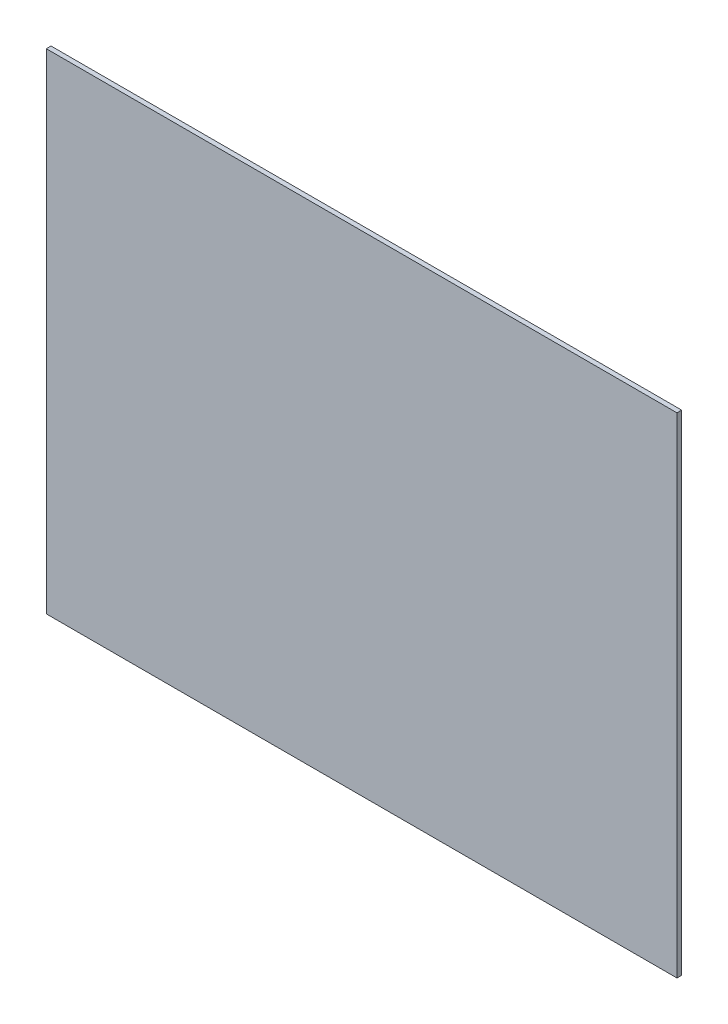
from build123d import *

# Parameters (mm, degrees)
SKETCH1_W           = 536
SKETCH1_H           = 416
BOSS_EXTRUDE1_DEPTH = 2


with BuildPart() as part:
    # Sketch1 → Boss-Extrude1 (new, symmetric)
    with BuildSketch(Plane.XY):
        Rectangle(SKETCH1_W, SKETCH1_H)
    extrude(amount=BOSS_EXTRUDE1_DEPTH, both=True)


solid = part.part
